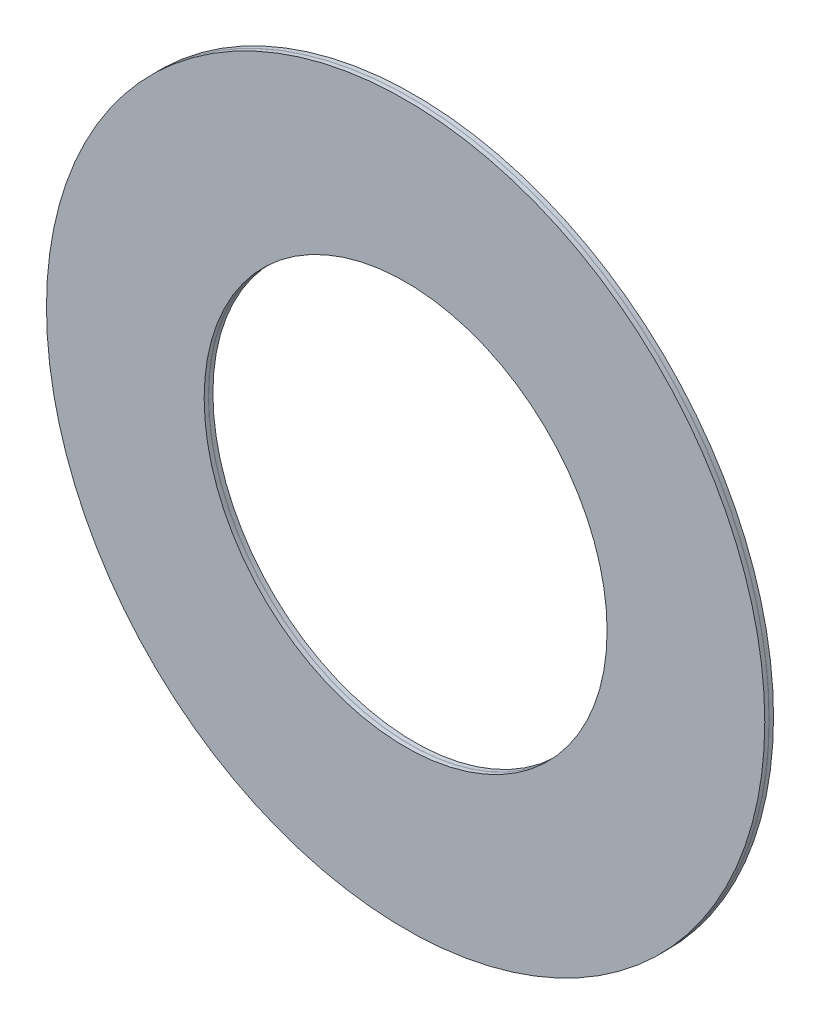
from build123d import *

# Parameters (mm, degrees)
SKETCH3_W = 0.0508
SKETCH3_H = 28.575
SKETCH4_W = 0.76835
SKETCH4_H = 28.575


with BuildPart() as part:
    # Sketch3 → Revolve1 (revolve)
    with BuildSketch(Plane(origin=(0, 0, 0), x_dir=(0, 0, -1), z_dir=(1, 0, 0))):
        with Locations((0, 50.8)):
            Rectangle(SKETCH3_W, SKETCH3_H)
    revolve(axis=Axis((0, 0, -0.79375), (0, 0, 1)))


with BuildPart() as body_2:
    # Sketch4 → Revolve2 (revolve)
    with BuildSketch(Plane(origin=(0, 0, 0), x_dir=(0, 0, -1), z_dir=(1, 0, 0))):
        with Locations((-0.409575, 50.8)):
            Rectangle(SKETCH4_W, SKETCH4_H)
        with Locations((0.409575, 50.8)):
            Rectangle(SKETCH4_W, SKETCH4_H)
    revolve(axis=Axis((0, 0, -0.79375), (0, 0, 1)))


solid = Compound([part.part, body_2.part])
